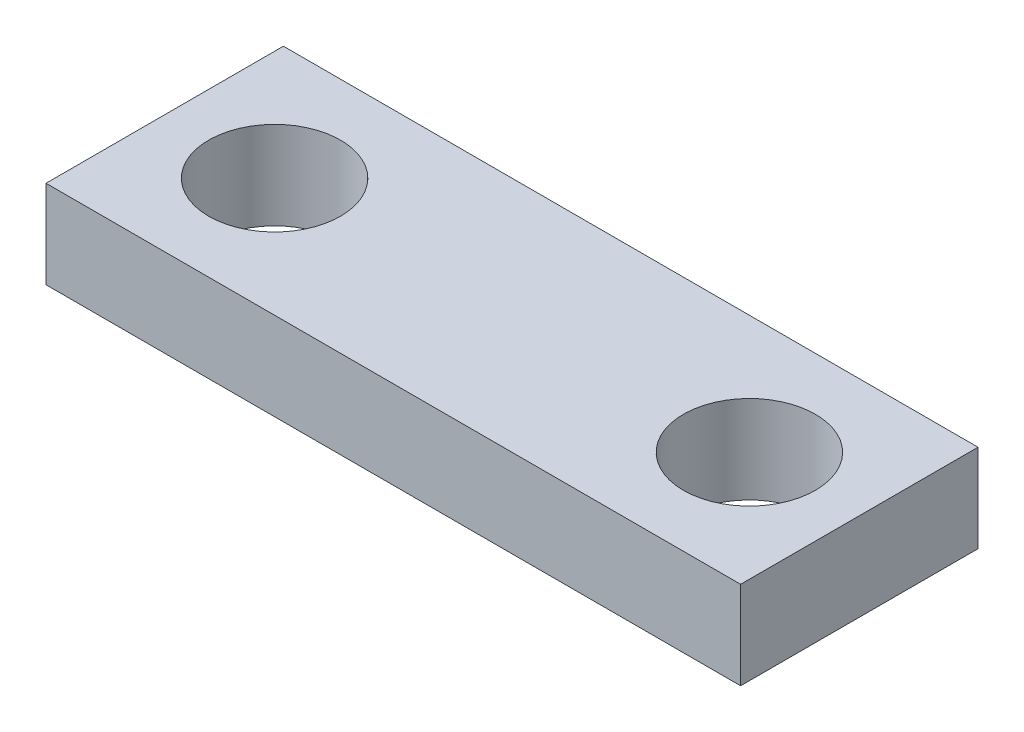
from build123d import *

# Parameters (mm, degrees)
SKETCH_1_W          = 79
SKETCH_1_H          = 27
EXTRUDE_1_DEPTH     = 10
SKETCH_3_R          = 7.5
CUT_EXTRUDE_1_DEPTH = 43.924352063


with BuildPart() as part:
    # 草图1 → 凸台-拉伸1 (new body)
    with BuildSketch(Plane(origin=(0, 0, 0), x_dir=(1, 0, 0), z_dir=(0, 1, 0))):
        Rectangle(SKETCH_1_W, SKETCH_1_H)
    extrude(amount=EXTRUDE_1_DEPTH)

    # 草图3 → 切除-拉伸1 (cut, through all)
    with BuildSketch(Plane(origin=(0, 10, 0), x_dir=(1, 0, 0), z_dir=(0, 1, 0))):
        with Locations((-27, 0)):
            Circle(SKETCH_3_R)
        with Locations((27, 0)):
            Circle(SKETCH_3_R)
    extrude(amount=-CUT_EXTRUDE_1_DEPTH, mode=Mode.SUBTRACT)


solid = part.part
